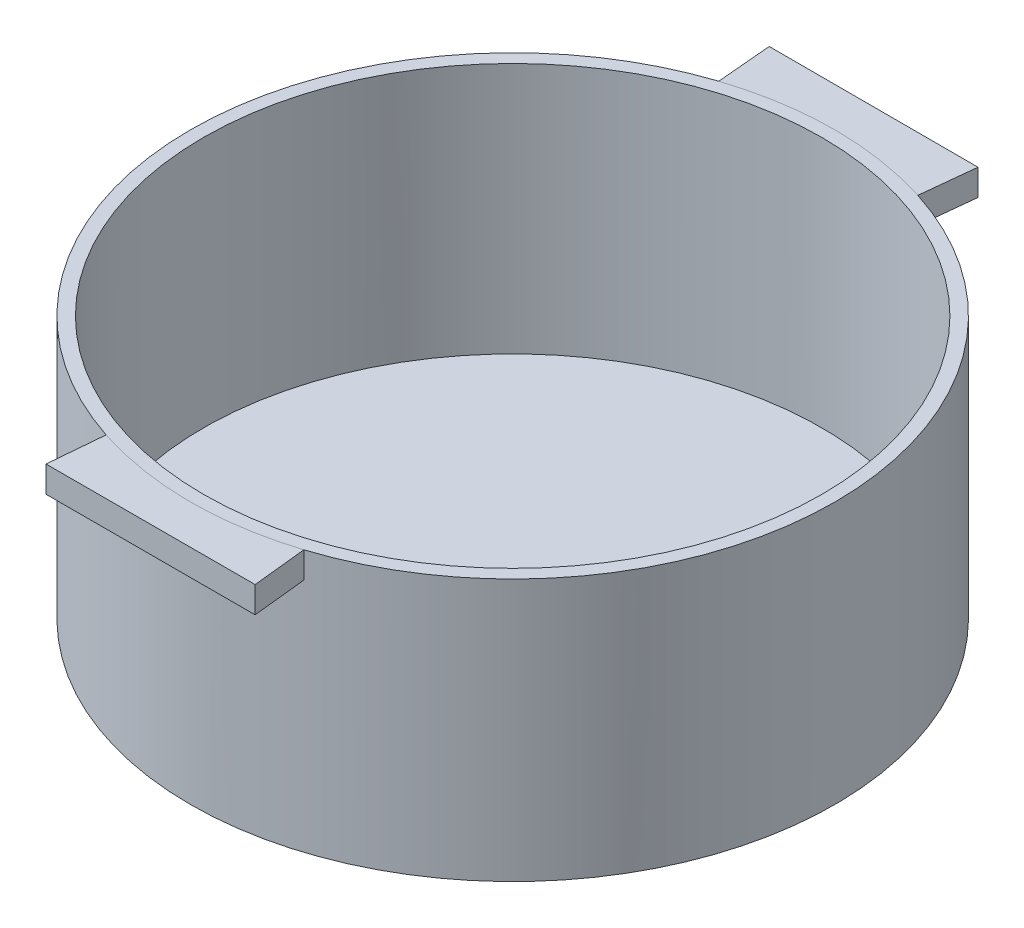
from build123d import *

# Parameters (mm, degrees)
SKETCH2_R           = 61.5
BOSS_EXTRUDE1_DEPTH = 50
SKETCH6_R           = 59
CUT_EXTRUDE1_DEPTH  = 48
SKETCH7_R           = 6
CUT_EXTRUDE4_DEPTH  = 2
SKETCH9_R           = 21
CUT_EXTRUDE5_DEPTH  = 3
BOSS_EXTRUDE2_START = -5
BOSS_EXTRUDE2_DEPTH = 5.0001
SCALE2_SCALE        = 1.5


# Read off the part's stored shape, not the designer's step: Boss-Extrude2
with BuildPart() as part:
    # Sketch2 → Boss-Extrude1 (new body)
    with BuildSketch(Plane(origin=(0, 0, 0), x_dir=(1, 0, 0), z_dir=(0, 1, 0))):
        with Locations(Location((0, 0, 0), (0, 0, 270))):
            Circle(SKETCH2_R)
    extrude(amount=BOSS_EXTRUDE1_DEPTH)

    # Sketch6 → Cut-Extrude1 (cut)
    with BuildSketch(Plane(origin=(0, 50, 0), x_dir=(1, 0, 0), z_dir=(0, 1, 0))):
        with Locations(Location((0, 0, 0), (0, 0, 270))):
            Circle(SKETCH6_R)
    extrude(amount=-CUT_EXTRUDE1_DEPTH, mode=Mode.SUBTRACT)

    # Sketch7 → Cut-Extrude4 (cut)
    with BuildSketch(Plane(origin=(0, 0, 0), x_dir=(1, 0, 0), z_dir=(0, 1, 0))):
        with Locations(Location((0, 0, 0), (0, 0, 270))):
            Circle(SKETCH7_R)
    extrude(amount=CUT_EXTRUDE4_DEPTH, mode=Mode.SUBTRACT)

    # Sketch9 → Cut-Extrude5 (cut)
    with BuildSketch(Plane(origin=(0, 0, 0), x_dir=(1, 0, 0), z_dir=(0, 1, 0))):
        with Locations(Location((0, -39.395608547, 0), (0, 0, 244.065435775))):
            Circle(SKETCH9_R)
    extrude(amount=CUT_EXTRUDE5_DEPTH, mode=Mode.SUBTRACT)

    # Boss-Extrude2 outline → Boss-Extrude2 (add)
    with BuildSketch(Plane(origin=(0, 50, 0), x_dir=(1, 0, 0), z_dir=(0, 1, 0)).offset(BOSS_EXTRUDE2_START)):
        with BuildLine():
            ThreePointArc((18.731112888, -58.578113745), (-0.20418242, -61.499661052), (-19.119661096, -58.452446994))
            Line((-19.119661096, -58.452446994), (-20.049464932, -68.999980107))
            Line((-20.049464932, -68.999980107), (19.825959412, -68.968020016))
            Line((19.825959412, -68.968020016), (18.731112888, -58.578113745))
        make_face()
        with BuildLine():
            Line((-20.049464932, 68.999980107), (-19.119661096, 58.452446994))
            ThreePointArc((-19.119661096, 58.452446994), (-0.20418242, 61.499661052), (18.731112888, 58.578113745))
            Line((18.731112888, 58.578113745), (19.825959412, 68.968020016))
            Line((19.825959412, 68.968020016), (-20.049464932, 68.999980107))
        make_face()
    extrude(amount=BOSS_EXTRUDE2_DEPTH)


with BuildPart() as part_1:
    # Scale2: scaled about (-0.009677872, 19.559028085, -1.585736767)
    add(part.part.scale(SCALE2_SCALE).moved(Location((0.004838936, -9.779514043, 0.792868383))))


solid = part_1.part
